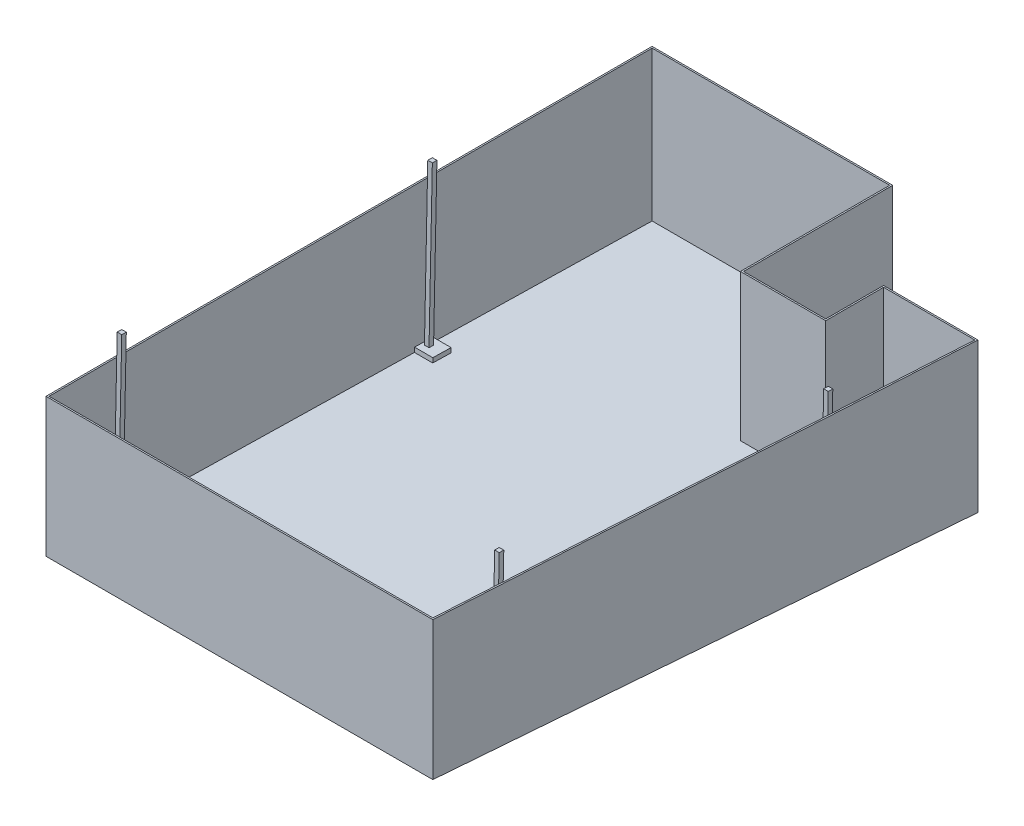
from build123d import *

# Parameters (mm, degrees)
BOSS_EXTRUDE2_DEPTH      = 2311.4
BOSS_EXTRUDE2_DEPTH_BACK = 254
CUT_EXTRUDE1_DEPTH       = 8907.603352569
SHELL3_T                 = -25.4
SKETCH5_W                = 304.8
SKETCH5_H                = 304.8
BOSS_EXTRUDE4_DEPTH      = 76.2
SKETCH6_W                = 76.2
SKETCH6_H                = 76.2
BOSS_EXTRUDE6_DEPTH      = 2643.378


with BuildPart() as part:
    # Sketch2 → Boss-Extrude2 (new, two sides: drawn at the far end of the back side and taken through both)
    with BuildSketch(Plane(origin=(0, 0, 0), x_dir=(1, 0, 0), z_dir=(0, 1, 0)).offset(-BOSS_EXTRUDE2_DEPTH_BACK)):
        Polygon((0, 5054.6), (0, -5054.6), (6451.6, -5054.6), (6959.6, 3530.6), (5384.8, 3530.6), (5384.8, 2565.4), (4013.2, 2565.4), (4013.2, 5054.6), align=None)
    extrude(amount=BOSS_EXTRUDE2_DEPTH + BOSS_EXTRUDE2_DEPTH_BACK)

    # Sketch4 → Cut-Extrude1 (cut, through all)
    with BuildSketch(Plane.ZY):
        Polygon((5054.6, 0), (-5054.6, -211.757553015), (-5054.6, -254), (5054.6, -254), align=None)
    extrude(amount=-CUT_EXTRUDE1_DEPTH, mode=Mode.SUBTRACT)

    # Shell3
    shell3_openings = [part.faces().sort_by_distance(p)[0] for p in [
        (3193.672214635, 2311.4, 297.114656183),
    ]]
    offset(amount=SHELL3_T, openings=shell3_openings, kind=Kind.INTERSECTION)

    # Sketch5 → Boss-Extrude4 (add)
    with BuildSketch(Plane(origin=(0, -80.43791031, 1.684934026), x_dir=(1, 0, 0), z_dir=(0, 0.9997806834748456, -0.020942419883350005))):
        with Locations((177.8, -3961.817924984)):
            Rectangle(SKETCH5_W, SKETCH5_H)
        with Locations((177.8, 1219.782075016)):
            Rectangle(SKETCH5_W, SKETCH5_H)
        Polygon((6501.521028173, 1067.382075016), (6788.289480699, 1067.382075016), (6806.321028173, 1372.182075016), (6501.521028173, 1372.182075016), align=None)
        Polygon((6194.451826209, -4114.217924984), (6481.753173628, -4114.217924984), (6499.784721103, -3809.417924984), (6194.451826209, -3809.417924984), align=None)
    extrude(amount=BOSS_EXTRUDE4_DEPTH)

    # Sketch6 → Boss-Extrude6 (add)
    with BuildSketch(Plane(origin=(0, -4.254622229, 0.089121631), x_dir=(1, 0, 0), z_dir=(0, 0.9997806834748456, -0.02094241988335002))):
        with Locations((114.3, 1219.782075016)):
            Rectangle(SKETCH6_W, SKETCH6_H)
        with Locations((114.3, -3961.817924984)):
            Rectangle(SKETCH6_W, SKETCH6_H)
        with Locations((6410.351826209, -3961.817924984)):
            Rectangle(SKETCH6_W, SKETCH6_H)
        with Locations((6717.421028173, 1219.782075016)):
            Rectangle(SKETCH6_W, SKETCH6_H)
    extrude(amount=BOSS_EXTRUDE6_DEPTH)


solid = part.part
